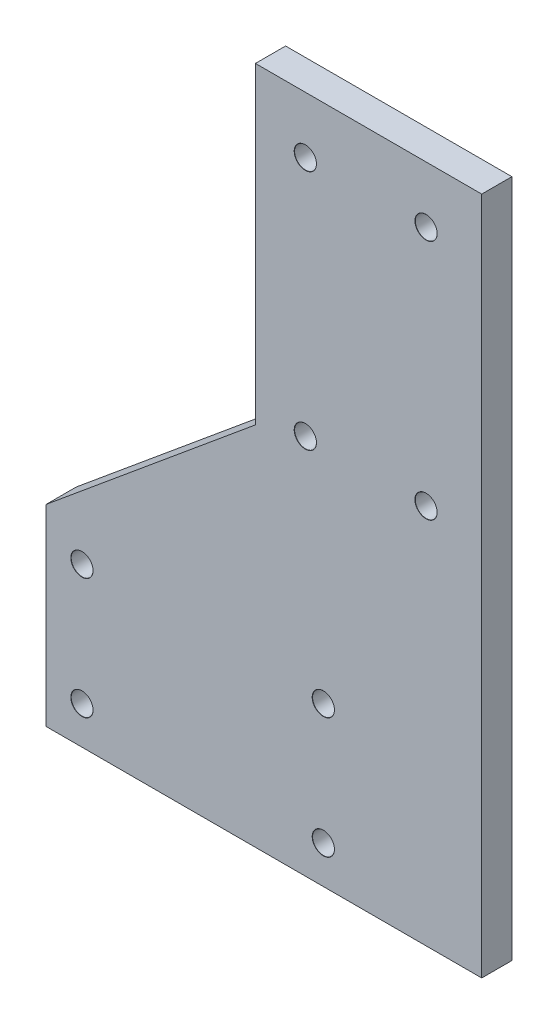
from build123d import *

# Parameters (mm, degrees)
EXTRUDE_1_DEPTH                = 4
HOLE_WIZARD_M2_5_1_D           = 2.9
HOLE_WIZARD_M2_5_1_CSINK_D     = 2.95
HOLE_WIZARD_M2_5_1_CSINK_ANGLE = 90


with BuildPart() as part:
    # 草图1 → 凸台-拉伸1 (new body)
    with BuildSketch(Plane.XY):
        Polygon((0, 0), (-41.5, 0), (-41.5, 25.5), (-13.75, 48.5), (-13.75, 90), (16.25, 90), (16.25, 0), align=None)
    extrude(amount=EXTRUDE_1_DEPTH)

    # M2.5 间隙孔1 (through all)
    with Locations(Plane.XY.offset(4)):
        with Locations((8.866379665, 50.5), (-36.75, 5), (-36.75, 21), (-4.75, 5), (-4.75, 21), (-7.133620335, 82.5), (8.866379665, 82.5), (-7.133620335, 50.5)):
            CounterSinkHole(HOLE_WIZARD_M2_5_1_D / 2, HOLE_WIZARD_M2_5_1_CSINK_D / 2, counter_sink_angle=HOLE_WIZARD_M2_5_1_CSINK_ANGLE)


solid = part.part
